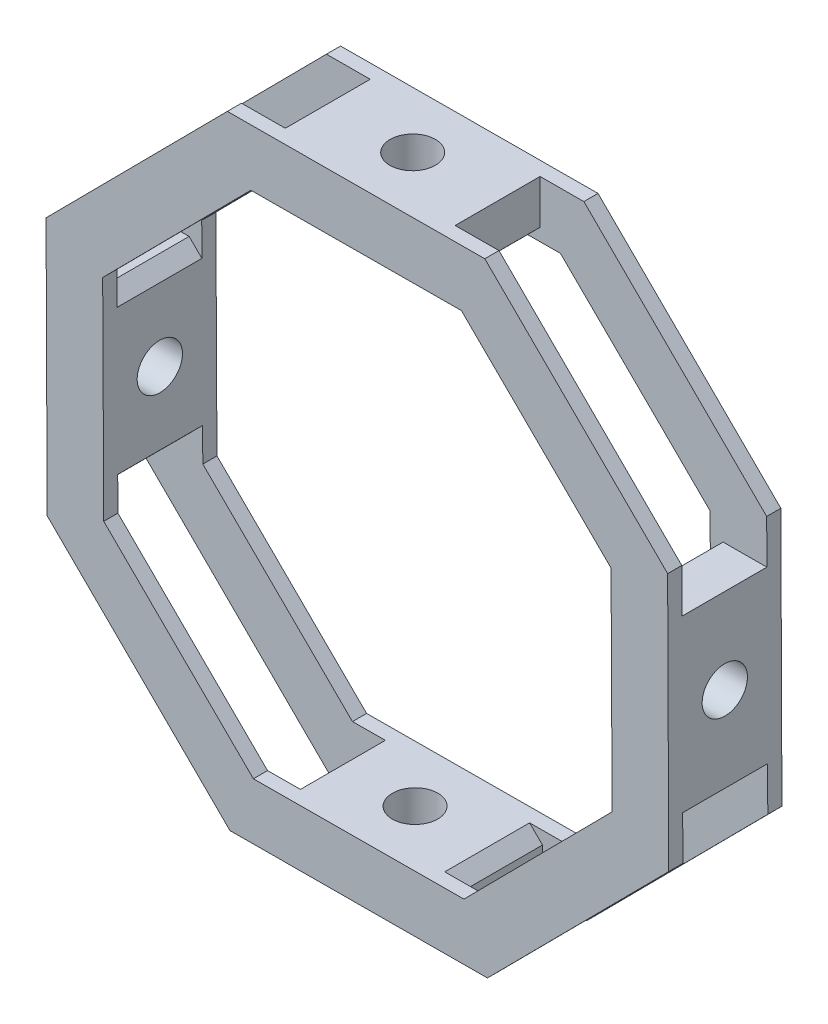
from build123d import *

# Parameters (mm, degrees)
RESSALTO_EXTRUS_O1_DEPTH   = 40
CORTE_EXTRUS_O1_DEPTH      = 250.234507985
CORTE_EXTRUS_O1_DEPTH_BACK = 250.234507985
ESBO_O2_R                  = 8
ESBO_O2_W                  = 30
ESBO_O2_H                  = 15.483966381
CORTE_EXTRUS_O2_DEPTH      = 250.234507985
CORTE_EXTRUS_O2_DEPTH_BACK = 250.234507985
ESBO_O3_R                  = 8
ESBO_O3_W                  = 15.483966381
ESBO_O3_H                  = 30
CORTE_EXTRUS_O3_DEPTH      = 269.368637705
CORTE_EXTRUS_O3_DEPTH_BACK = 269.368637705
ESBO_O4_W                  = 30
ESBO_O4_H                  = 90.967932762
CORTE_EXTRUS_O4_DEPTH      = 269.368637705
CORTE_EXTRUS_O4_DEPTH_BACK = 269.368637705
ESBO_O5_W                  = 30
ESBO_O5_H                  = 90.967932762


with BuildPart() as part:
    # Esboço1 → Ressalto-extrusão1 (new body)
    with BuildSketch(Plane.XY):
        Polygon((109.614040303, 45.949451558), (45.017662423, 110), (-45.949451558, 109.614040303), (-110, 45.017662423), (-109.614040303, -45.949451558), (-45.017662423, -110), (45.949451558, -109.614040303), (110, -45.017662423), align=None)
        Polygon((89.622191138, 37.657029476), (36.744918196, 90), (-37.657029476, 89.622191138), (-90, 36.744918196), (-89.622191138, -37.657029476), (-36.744918196, -90), (37.657029476, -89.622191138), (90, -36.744918196), align=None, mode=Mode.SUBTRACT)
    extrude(amount=RESSALTO_EXTRUS_O1_DEPTH)

    # Esboço2 → Corte-extrusão1 (cut, two sides: drawn at the far end of the back side and taken through both)
    with BuildSketch(Plane(origin=(109.807020152, 0.465894567, 0), x_dir=(0, 0, -1), z_dir=(0.9999909992391912, 0.004242810460553787, 0)).offset(-CORTE_EXTRUS_O1_DEPTH_BACK)):
        with Locations((-20, 0)):
            Circle(ESBO_O2_R)
        with Locations((-20, 37.741983191)):
            Rectangle(ESBO_O2_W, ESBO_O2_H)
        with Locations((-20, -37.741983191)):
            Rectangle(ESBO_O2_W, ESBO_O2_H)
    extrude(amount=CORTE_EXTRUS_O1_DEPTH + CORTE_EXTRUS_O1_DEPTH_BACK, mode=Mode.SUBTRACT)

    # Esboço3 → Corte-extrusão2 (cut, two sides: drawn at the far end of the back side and taken through both)
    with BuildSketch(Plane(origin=(-0.465894567, 109.807020152, 0), x_dir=(0.9999909992391912, 0.004242810460554241, 0), z_dir=(-0.004242810460554241, 0.9999909992391912, 0)).offset(-CORTE_EXTRUS_O2_DEPTH_BACK)):
        with Locations((0, -20)):
            Circle(ESBO_O3_R)
        with Locations((37.741983191, -20)):
            Rectangle(ESBO_O3_W, ESBO_O3_H)
        with Locations((-37.741983191, -20)):
            Rectangle(ESBO_O3_W, ESBO_O3_H)
    extrude(amount=CORTE_EXTRUS_O2_DEPTH + CORTE_EXTRUS_O2_DEPTH_BACK, mode=Mode.SUBTRACT)

    # Esboço4 → Corte-extrusão3 (cut, two sides: drawn at the far end of the back side and taken through both)
    with BuildSketch(Plane(origin=(77.315851363, 77.974725779, 0), x_dir=(0, 0, -1), z_dir=(0.7041002966395966, 0.7101005367354908, 0)).offset(-CORTE_EXTRUS_O3_DEPTH_BACK)):
        with Locations((-20, 0)):
            Rectangle(ESBO_O4_W, ESBO_O4_H)
    extrude(amount=CORTE_EXTRUS_O3_DEPTH + CORTE_EXTRUS_O3_DEPTH_BACK, mode=Mode.SUBTRACT)

    # Esboço5 → Corte-extrusão4 (cut, two sides: drawn at the far end of the back side and taken through both)
    with BuildSketch(Plane(origin=(-77.974725779, 77.315851363, 0), x_dir=(0, 0, 1), z_dir=(-0.7101005367354906, 0.7041002966395968, 0)).offset(-CORTE_EXTRUS_O4_DEPTH_BACK)):
        with Locations((20, 0)):
            Rectangle(ESBO_O5_W, ESBO_O5_H)
    extrude(amount=CORTE_EXTRUS_O4_DEPTH + CORTE_EXTRUS_O4_DEPTH_BACK, mode=Mode.SUBTRACT)


solid = part.part
